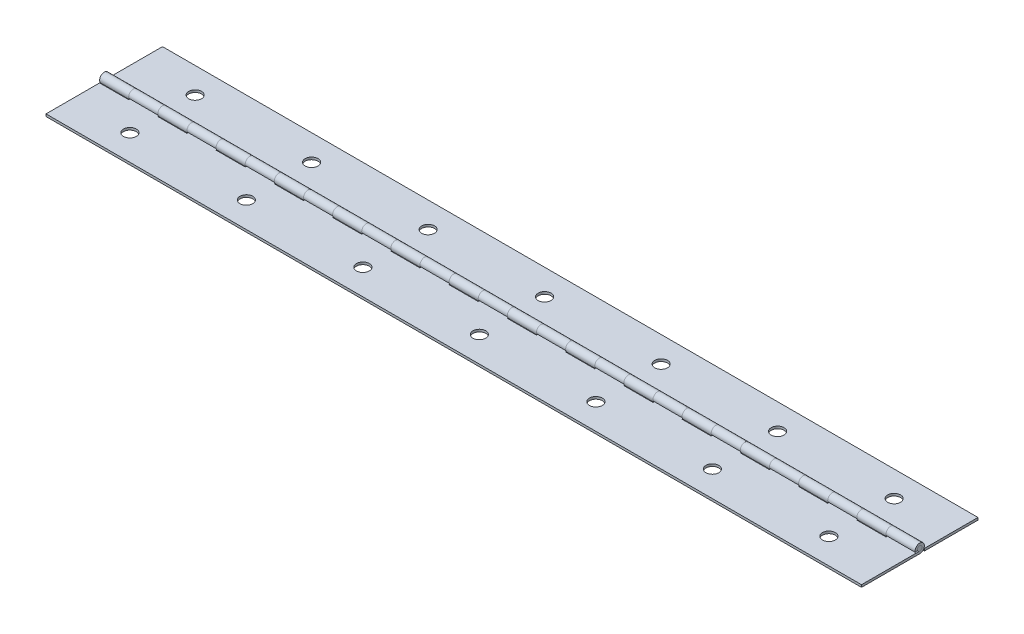
from build123d import *

# Parameters (mm, degrees)
BOSS_EXTRUDE1_DEPTH                  = 1828.8
SKETCH2_W                            = 12.7
SKETCH2_H                            = 4.064
CUT_EXTRUDE1_DEPTH                   = 1829.978920137
LPATTERN1_COUNT                      = 72
LPATTERN1_PITCH                      = 25.4
BOSS_EXTRUDE2_DEPTH                  = 1828.8
SKETCH4_W                            = 12.7
SKETCH4_H                            = 4.064
CUT_EXTRUDE2_DEPTH                   = 1829.978920137
LPATTERN3_COUNT                      = 72
LPATTERN3_PITCH                      = 25.4
SKETCH5_R                            = 1.016
BOSS_EXTRUDE4_DEPTH                  = 1828.8
SKETCH7_W                            = 2.8067
SKETCH7_H                            = 1.016
F_2_0_221_DIAMETER_HOLE1_AT_2_COUNT  = 2
F_2_0_221_DIAMETER_HOLE1_AT_2_PITCH  = 50.8
F_2_0_221_DIAMETER_HOLE1_AT_3_COUNT  = 2
F_2_0_221_DIAMETER_HOLE1_AT_3_PITCH  = 101.6
F_2_0_221_DIAMETER_HOLE1_AT_4_COUNT  = 2
F_2_0_221_DIAMETER_HOLE1_AT_4_PITCH  = 152.4
F_2_0_221_DIAMETER_HOLE1_AT_5_COUNT  = 2
F_2_0_221_DIAMETER_HOLE1_AT_5_PITCH  = 203.2
F_2_0_221_DIAMETER_HOLE1_AT_6_COUNT  = 2
F_2_0_221_DIAMETER_HOLE1_AT_6_PITCH  = 254
F_2_0_221_DIAMETER_HOLE1_AT_7_COUNT  = 2
F_2_0_221_DIAMETER_HOLE1_AT_7_PITCH  = 304.8
F_2_0_221_DIAMETER_HOLE1_AT_8_COUNT  = 2
F_2_0_221_DIAMETER_HOLE1_AT_8_PITCH  = 355.6
F_2_0_221_DIAMETER_HOLE1_AT_9_COUNT  = 2
F_2_0_221_DIAMETER_HOLE1_AT_9_PITCH  = 406.4
F_2_0_221_DIAMETER_HOLE1_AT_10_COUNT = 2
F_2_0_221_DIAMETER_HOLE1_AT_10_PITCH = 457.2
F_2_0_221_DIAMETER_HOLE1_AT_11_COUNT = 2
F_2_0_221_DIAMETER_HOLE1_AT_11_PITCH = 508
F_2_0_221_DIAMETER_HOLE1_AT_12_COUNT = 2
F_2_0_221_DIAMETER_HOLE1_AT_12_PITCH = 558.8
F_2_0_221_DIAMETER_HOLE1_AT_13_COUNT = 2
F_2_0_221_DIAMETER_HOLE1_AT_13_PITCH = 609.6
F_2_0_221_DIAMETER_HOLE1_AT_14_COUNT = 2
F_2_0_221_DIAMETER_HOLE1_AT_14_PITCH = 660.4
F_2_0_221_DIAMETER_HOLE1_AT_15_COUNT = 2
F_2_0_221_DIAMETER_HOLE1_AT_15_PITCH = 711.2
F_2_0_221_DIAMETER_HOLE1_AT_16_COUNT = 2
F_2_0_221_DIAMETER_HOLE1_AT_16_PITCH = 762
F_2_0_221_DIAMETER_HOLE1_AT_17_COUNT = 2
F_2_0_221_DIAMETER_HOLE1_AT_17_PITCH = 812.8
F_2_0_221_DIAMETER_HOLE1_AT_18_COUNT = 2
F_2_0_221_DIAMETER_HOLE1_AT_18_PITCH = 863.6
F_2_0_221_DIAMETER_HOLE1_AT_19_COUNT = 2
F_2_0_221_DIAMETER_HOLE1_AT_19_PITCH = 914.4
F_2_0_221_DIAMETER_HOLE1_AT_20_COUNT = 2
F_2_0_221_DIAMETER_HOLE1_AT_20_PITCH = 965.2
F_2_0_221_DIAMETER_HOLE1_AT_21_COUNT = 2
F_2_0_221_DIAMETER_HOLE1_AT_21_PITCH = 1016
F_2_0_221_DIAMETER_HOLE1_AT_22_COUNT = 2
F_2_0_221_DIAMETER_HOLE1_AT_22_PITCH = 1066.8
F_2_0_221_DIAMETER_HOLE1_AT_23_COUNT = 2
F_2_0_221_DIAMETER_HOLE1_AT_23_PITCH = 1117.6
F_2_0_221_DIAMETER_HOLE1_AT_24_COUNT = 2
F_2_0_221_DIAMETER_HOLE1_AT_24_PITCH = 1168.4
F_2_0_221_DIAMETER_HOLE1_AT_25_COUNT = 2
F_2_0_221_DIAMETER_HOLE1_AT_25_PITCH = 1219.2
F_2_0_221_DIAMETER_HOLE1_AT_26_COUNT = 2
F_2_0_221_DIAMETER_HOLE1_AT_26_PITCH = 1270
F_2_0_221_DIAMETER_HOLE1_AT_27_COUNT = 2
F_2_0_221_DIAMETER_HOLE1_AT_27_PITCH = 1320.8
F_2_0_221_DIAMETER_HOLE1_AT_28_COUNT = 2
F_2_0_221_DIAMETER_HOLE1_AT_28_PITCH = 1371.6
F_2_0_221_DIAMETER_HOLE1_AT_29_COUNT = 2
F_2_0_221_DIAMETER_HOLE1_AT_29_PITCH = 1422.4
F_2_0_221_DIAMETER_HOLE1_AT_30_COUNT = 2
F_2_0_221_DIAMETER_HOLE1_AT_30_PITCH = 1473.2
F_2_0_221_DIAMETER_HOLE1_AT_31_COUNT = 2
F_2_0_221_DIAMETER_HOLE1_AT_31_PITCH = 1524
F_2_0_221_DIAMETER_HOLE1_AT_32_COUNT = 2
F_2_0_221_DIAMETER_HOLE1_AT_32_PITCH = 1574.8
F_2_0_221_DIAMETER_HOLE1_AT_33_COUNT = 2
F_2_0_221_DIAMETER_HOLE1_AT_33_PITCH = 1625.6
F_2_0_221_DIAMETER_HOLE1_AT_34_COUNT = 2
F_2_0_221_DIAMETER_HOLE1_AT_34_PITCH = 1676.4
F_2_0_221_DIAMETER_HOLE1_AT_35_COUNT = 2
F_2_0_221_DIAMETER_HOLE1_AT_35_PITCH = 1727.2
F_2_0_221_DIAMETER_HOLE1_AT_36_COUNT = 2
F_2_0_221_DIAMETER_HOLE1_AT_36_PITCH = 1778
SKETCH9_W                            = 2.8067
SKETCH9_H                            = 1.016
F_2_0_221_DIAMETER_HOLE2_AT_2_COUNT  = 2
F_2_0_221_DIAMETER_HOLE2_AT_2_PITCH  = 50.8
F_2_0_221_DIAMETER_HOLE2_AT_3_COUNT  = 2
F_2_0_221_DIAMETER_HOLE2_AT_3_PITCH  = 101.6
F_2_0_221_DIAMETER_HOLE2_AT_4_COUNT  = 2
F_2_0_221_DIAMETER_HOLE2_AT_4_PITCH  = 152.4
F_2_0_221_DIAMETER_HOLE2_AT_5_COUNT  = 2
F_2_0_221_DIAMETER_HOLE2_AT_5_PITCH  = 203.2
F_2_0_221_DIAMETER_HOLE2_AT_6_COUNT  = 2
F_2_0_221_DIAMETER_HOLE2_AT_6_PITCH  = 254
F_2_0_221_DIAMETER_HOLE2_AT_7_COUNT  = 2
F_2_0_221_DIAMETER_HOLE2_AT_7_PITCH  = 304.8
F_2_0_221_DIAMETER_HOLE2_AT_8_COUNT  = 2
F_2_0_221_DIAMETER_HOLE2_AT_8_PITCH  = 355.6
F_2_0_221_DIAMETER_HOLE2_AT_9_COUNT  = 2
F_2_0_221_DIAMETER_HOLE2_AT_9_PITCH  = 406.4
F_2_0_221_DIAMETER_HOLE2_AT_10_COUNT = 2
F_2_0_221_DIAMETER_HOLE2_AT_10_PITCH = 457.2
F_2_0_221_DIAMETER_HOLE2_AT_11_COUNT = 2
F_2_0_221_DIAMETER_HOLE2_AT_11_PITCH = 508
F_2_0_221_DIAMETER_HOLE2_AT_12_COUNT = 2
F_2_0_221_DIAMETER_HOLE2_AT_12_PITCH = 558.8
F_2_0_221_DIAMETER_HOLE2_AT_13_COUNT = 2
F_2_0_221_DIAMETER_HOLE2_AT_13_PITCH = 609.6
F_2_0_221_DIAMETER_HOLE2_AT_14_COUNT = 2
F_2_0_221_DIAMETER_HOLE2_AT_14_PITCH = 660.4
F_2_0_221_DIAMETER_HOLE2_AT_15_COUNT = 2
F_2_0_221_DIAMETER_HOLE2_AT_15_PITCH = 711.2
F_2_0_221_DIAMETER_HOLE2_AT_16_COUNT = 2
F_2_0_221_DIAMETER_HOLE2_AT_16_PITCH = 762
F_2_0_221_DIAMETER_HOLE2_AT_17_COUNT = 2
F_2_0_221_DIAMETER_HOLE2_AT_17_PITCH = 812.8
F_2_0_221_DIAMETER_HOLE2_AT_18_COUNT = 2
F_2_0_221_DIAMETER_HOLE2_AT_18_PITCH = 863.6
F_2_0_221_DIAMETER_HOLE2_AT_19_COUNT = 2
F_2_0_221_DIAMETER_HOLE2_AT_19_PITCH = 914.4
F_2_0_221_DIAMETER_HOLE2_AT_20_COUNT = 2
F_2_0_221_DIAMETER_HOLE2_AT_20_PITCH = 965.2
F_2_0_221_DIAMETER_HOLE2_AT_21_COUNT = 2
F_2_0_221_DIAMETER_HOLE2_AT_21_PITCH = 1016
F_2_0_221_DIAMETER_HOLE2_AT_22_COUNT = 2
F_2_0_221_DIAMETER_HOLE2_AT_22_PITCH = 1066.8
F_2_0_221_DIAMETER_HOLE2_AT_23_COUNT = 2
F_2_0_221_DIAMETER_HOLE2_AT_23_PITCH = 1117.6
F_2_0_221_DIAMETER_HOLE2_AT_24_COUNT = 2
F_2_0_221_DIAMETER_HOLE2_AT_24_PITCH = 1168.4
F_2_0_221_DIAMETER_HOLE2_AT_25_COUNT = 2
F_2_0_221_DIAMETER_HOLE2_AT_25_PITCH = 1219.2
F_2_0_221_DIAMETER_HOLE2_AT_26_COUNT = 2
F_2_0_221_DIAMETER_HOLE2_AT_26_PITCH = 1270
F_2_0_221_DIAMETER_HOLE2_AT_27_COUNT = 2
F_2_0_221_DIAMETER_HOLE2_AT_27_PITCH = 1320.8
F_2_0_221_DIAMETER_HOLE2_AT_28_COUNT = 2
F_2_0_221_DIAMETER_HOLE2_AT_28_PITCH = 1371.6
F_2_0_221_DIAMETER_HOLE2_AT_29_COUNT = 2
F_2_0_221_DIAMETER_HOLE2_AT_29_PITCH = 1422.4
F_2_0_221_DIAMETER_HOLE2_AT_30_COUNT = 2
F_2_0_221_DIAMETER_HOLE2_AT_30_PITCH = 1473.2
F_2_0_221_DIAMETER_HOLE2_AT_31_COUNT = 2
F_2_0_221_DIAMETER_HOLE2_AT_31_PITCH = 1524
F_2_0_221_DIAMETER_HOLE2_AT_32_COUNT = 2
F_2_0_221_DIAMETER_HOLE2_AT_32_PITCH = 1574.8
F_2_0_221_DIAMETER_HOLE2_AT_33_COUNT = 2
F_2_0_221_DIAMETER_HOLE2_AT_33_PITCH = 1625.6
F_2_0_221_DIAMETER_HOLE2_AT_34_COUNT = 2
F_2_0_221_DIAMETER_HOLE2_AT_34_PITCH = 1676.4
F_2_0_221_DIAMETER_HOLE2_AT_35_COUNT = 2
F_2_0_221_DIAMETER_HOLE2_AT_35_PITCH = 1727.2
F_2_0_221_DIAMETER_HOLE2_AT_36_COUNT = 2
F_2_0_221_DIAMETER_HOLE2_AT_36_PITCH = 1778
CUT_EXTRUDE3_DEPTH                   = 1829.978920137
CUT_EXTRUDE3_DEPTH_BACK              = 1829.978920137
SKETCH10_W                           = 1473.2
SKETCH10_H                           = 50.8


with BuildPart() as part:
    # Sketch1 → Boss-Extrude1 (new body)
    with BuildSketch(Plane(origin=(0, 0, 0), x_dir=(0, 0, -1), z_dir=(1, 0, 0))):
        with BuildLine():
            Line((25.4, 1.016), (0, 1.016))
            ThreePointArc((0, 1.016), (-0.622170395, 2.835218526), (0.98373777, 1.778))
            Line((0.98373777, 1.778), (1.96747554, 1.524))
            ThreePointArc((1.96747554, 1.524), (-1.244340789, 3.638437051), (0, 0))
            Line((0, 0), (25.4, 0))
            Line((25.4, 0), (25.4, 1.016))
        make_face()
    extrude(amount=BOSS_EXTRUDE1_DEPTH)

    # Sketch2 → Cut-Extrude1 (cut, symmetric)
    with BuildSketch(Plane(origin=(0, 1.016, 0), x_dir=(1, 0, 0), z_dir=(0, 1, 0))):
        with Locations((19.05, 0)):
            Rectangle(SKETCH2_W, SKETCH2_H)
    cut_extrude1 = extrude(amount=CUT_EXTRUDE1_DEPTH, both=True, mode=Mode.SUBTRACT)

    # LPattern1: Cut-Extrude1 ×72
    with Locations(*[(i * LPATTERN1_PITCH, 0, 0) for i in range(1, LPATTERN1_COUNT)]):
        add(cut_extrude1, mode=Mode.SUBTRACT)

    # Sketch9 → #2 (0.221) Diameter Hole2 (revolve, cut)
    with BuildSketch(Plane(origin=(25.4, 1.016, -14.224), x_dir=(0, 0, 1), z_dir=(1, 0, 0))):
        with Locations((1.40335, 0.508)):
            Rectangle(SKETCH9_W, SKETCH9_H)
    f_2_0_221_diameter_hole2 = revolve(axis=Axis((25.4, 7.366, -14.224), (0, -1, 0)), mode=Mode.SUBTRACT)

    # #2 (0.221) Diameter Hole2 at 2: #2 (0.221) Diameter Hole2 ×2
    with Locations(*[(i * F_2_0_221_DIAMETER_HOLE2_AT_2_PITCH, 0, 0) for i in range(1, F_2_0_221_DIAMETER_HOLE2_AT_2_COUNT)]):
        add(f_2_0_221_diameter_hole2, mode=Mode.SUBTRACT)

    # #2 (0.221) Diameter Hole2 at 3: #2 (0.221) Diameter Hole2 ×2
    with Locations(*[(i * F_2_0_221_DIAMETER_HOLE2_AT_3_PITCH, 0, 0) for i in range(1, F_2_0_221_DIAMETER_HOLE2_AT_3_COUNT)]):
        add(f_2_0_221_diameter_hole2, mode=Mode.SUBTRACT)

    # #2 (0.221) Diameter Hole2 at 4: #2 (0.221) Diameter Hole2 ×2
    with Locations(*[(i * F_2_0_221_DIAMETER_HOLE2_AT_4_PITCH, 0, 0) for i in range(1, F_2_0_221_DIAMETER_HOLE2_AT_4_COUNT)]):
        add(f_2_0_221_diameter_hole2, mode=Mode.SUBTRACT)

    # #2 (0.221) Diameter Hole2 at 5: #2 (0.221) Diameter Hole2 ×2
    with Locations(*[(i * F_2_0_221_DIAMETER_HOLE2_AT_5_PITCH, 0, 0) for i in range(1, F_2_0_221_DIAMETER_HOLE2_AT_5_COUNT)]):
        add(f_2_0_221_diameter_hole2, mode=Mode.SUBTRACT)

    # #2 (0.221) Diameter Hole2 at 6: #2 (0.221) Diameter Hole2 ×2
    with Locations(*[(i * F_2_0_221_DIAMETER_HOLE2_AT_6_PITCH, 0, 0) for i in range(1, F_2_0_221_DIAMETER_HOLE2_AT_6_COUNT)]):
        add(f_2_0_221_diameter_hole2, mode=Mode.SUBTRACT)

    # #2 (0.221) Diameter Hole2 at 7: #2 (0.221) Diameter Hole2 ×2
    with Locations(*[(i * F_2_0_221_DIAMETER_HOLE2_AT_7_PITCH, 0, 0) for i in range(1, F_2_0_221_DIAMETER_HOLE2_AT_7_COUNT)]):
        add(f_2_0_221_diameter_hole2, mode=Mode.SUBTRACT)

    # #2 (0.221) Diameter Hole2 at 8: #2 (0.221) Diameter Hole2 ×2
    with Locations(*[(i * F_2_0_221_DIAMETER_HOLE2_AT_8_PITCH, 0, 0) for i in range(1, F_2_0_221_DIAMETER_HOLE2_AT_8_COUNT)]):
        add(f_2_0_221_diameter_hole2, mode=Mode.SUBTRACT)

    # #2 (0.221) Diameter Hole2 at 9: #2 (0.221) Diameter Hole2 ×2
    with Locations(*[(i * F_2_0_221_DIAMETER_HOLE2_AT_9_PITCH, 0, 0) for i in range(1, F_2_0_221_DIAMETER_HOLE2_AT_9_COUNT)]):
        add(f_2_0_221_diameter_hole2, mode=Mode.SUBTRACT)

    # #2 (0.221) Diameter Hole2 at 10: #2 (0.221) Diameter Hole2 ×2
    with Locations(*[(i * F_2_0_221_DIAMETER_HOLE2_AT_10_PITCH, 0, 0) for i in range(1, F_2_0_221_DIAMETER_HOLE2_AT_10_COUNT)]):
        add(f_2_0_221_diameter_hole2, mode=Mode.SUBTRACT)

    # #2 (0.221) Diameter Hole2 at 11: #2 (0.221) Diameter Hole2 ×2
    with Locations(*[(i * F_2_0_221_DIAMETER_HOLE2_AT_11_PITCH, 0, 0) for i in range(1, F_2_0_221_DIAMETER_HOLE2_AT_11_COUNT)]):
        add(f_2_0_221_diameter_hole2, mode=Mode.SUBTRACT)

    # #2 (0.221) Diameter Hole2 at 12: #2 (0.221) Diameter Hole2 ×2
    with Locations(*[(i * F_2_0_221_DIAMETER_HOLE2_AT_12_PITCH, 0, 0) for i in range(1, F_2_0_221_DIAMETER_HOLE2_AT_12_COUNT)]):
        add(f_2_0_221_diameter_hole2, mode=Mode.SUBTRACT)

    # #2 (0.221) Diameter Hole2 at 13: #2 (0.221) Diameter Hole2 ×2
    with Locations(*[(i * F_2_0_221_DIAMETER_HOLE2_AT_13_PITCH, 0, 0) for i in range(1, F_2_0_221_DIAMETER_HOLE2_AT_13_COUNT)]):
        add(f_2_0_221_diameter_hole2, mode=Mode.SUBTRACT)

    # #2 (0.221) Diameter Hole2 at 14: #2 (0.221) Diameter Hole2 ×2
    with Locations(*[(i * F_2_0_221_DIAMETER_HOLE2_AT_14_PITCH, 0, 0) for i in range(1, F_2_0_221_DIAMETER_HOLE2_AT_14_COUNT)]):
        add(f_2_0_221_diameter_hole2, mode=Mode.SUBTRACT)

    # #2 (0.221) Diameter Hole2 at 15: #2 (0.221) Diameter Hole2 ×2
    with Locations(*[(i * F_2_0_221_DIAMETER_HOLE2_AT_15_PITCH, 0, 0) for i in range(1, F_2_0_221_DIAMETER_HOLE2_AT_15_COUNT)]):
        add(f_2_0_221_diameter_hole2, mode=Mode.SUBTRACT)

    # #2 (0.221) Diameter Hole2 at 16: #2 (0.221) Diameter Hole2 ×2
    with Locations(*[(i * F_2_0_221_DIAMETER_HOLE2_AT_16_PITCH, 0, 0) for i in range(1, F_2_0_221_DIAMETER_HOLE2_AT_16_COUNT)]):
        add(f_2_0_221_diameter_hole2, mode=Mode.SUBTRACT)

    # #2 (0.221) Diameter Hole2 at 17: #2 (0.221) Diameter Hole2 ×2
    with Locations(*[(i * F_2_0_221_DIAMETER_HOLE2_AT_17_PITCH, 0, 0) for i in range(1, F_2_0_221_DIAMETER_HOLE2_AT_17_COUNT)]):
        add(f_2_0_221_diameter_hole2, mode=Mode.SUBTRACT)

    # #2 (0.221) Diameter Hole2 at 18: #2 (0.221) Diameter Hole2 ×2
    with Locations(*[(i * F_2_0_221_DIAMETER_HOLE2_AT_18_PITCH, 0, 0) for i in range(1, F_2_0_221_DIAMETER_HOLE2_AT_18_COUNT)]):
        add(f_2_0_221_diameter_hole2, mode=Mode.SUBTRACT)

    # #2 (0.221) Diameter Hole2 at 19: #2 (0.221) Diameter Hole2 ×2
    with Locations(*[(i * F_2_0_221_DIAMETER_HOLE2_AT_19_PITCH, 0, 0) for i in range(1, F_2_0_221_DIAMETER_HOLE2_AT_19_COUNT)]):
        add(f_2_0_221_diameter_hole2, mode=Mode.SUBTRACT)

    # #2 (0.221) Diameter Hole2 at 20: #2 (0.221) Diameter Hole2 ×2
    with Locations(*[(i * F_2_0_221_DIAMETER_HOLE2_AT_20_PITCH, 0, 0) for i in range(1, F_2_0_221_DIAMETER_HOLE2_AT_20_COUNT)]):
        add(f_2_0_221_diameter_hole2, mode=Mode.SUBTRACT)

    # #2 (0.221) Diameter Hole2 at 21: #2 (0.221) Diameter Hole2 ×2
    with Locations(*[(i * F_2_0_221_DIAMETER_HOLE2_AT_21_PITCH, 0, 0) for i in range(1, F_2_0_221_DIAMETER_HOLE2_AT_21_COUNT)]):
        add(f_2_0_221_diameter_hole2, mode=Mode.SUBTRACT)

    # #2 (0.221) Diameter Hole2 at 22: #2 (0.221) Diameter Hole2 ×2
    with Locations(*[(i * F_2_0_221_DIAMETER_HOLE2_AT_22_PITCH, 0, 0) for i in range(1, F_2_0_221_DIAMETER_HOLE2_AT_22_COUNT)]):
        add(f_2_0_221_diameter_hole2, mode=Mode.SUBTRACT)

    # #2 (0.221) Diameter Hole2 at 23: #2 (0.221) Diameter Hole2 ×2
    with Locations(*[(i * F_2_0_221_DIAMETER_HOLE2_AT_23_PITCH, 0, 0) for i in range(1, F_2_0_221_DIAMETER_HOLE2_AT_23_COUNT)]):
        add(f_2_0_221_diameter_hole2, mode=Mode.SUBTRACT)

    # #2 (0.221) Diameter Hole2 at 24: #2 (0.221) Diameter Hole2 ×2
    with Locations(*[(i * F_2_0_221_DIAMETER_HOLE2_AT_24_PITCH, 0, 0) for i in range(1, F_2_0_221_DIAMETER_HOLE2_AT_24_COUNT)]):
        add(f_2_0_221_diameter_hole2, mode=Mode.SUBTRACT)

    # #2 (0.221) Diameter Hole2 at 25: #2 (0.221) Diameter Hole2 ×2
    with Locations(*[(i * F_2_0_221_DIAMETER_HOLE2_AT_25_PITCH, 0, 0) for i in range(1, F_2_0_221_DIAMETER_HOLE2_AT_25_COUNT)]):
        add(f_2_0_221_diameter_hole2, mode=Mode.SUBTRACT)

    # #2 (0.221) Diameter Hole2 at 26: #2 (0.221) Diameter Hole2 ×2
    with Locations(*[(i * F_2_0_221_DIAMETER_HOLE2_AT_26_PITCH, 0, 0) for i in range(1, F_2_0_221_DIAMETER_HOLE2_AT_26_COUNT)]):
        add(f_2_0_221_diameter_hole2, mode=Mode.SUBTRACT)

    # #2 (0.221) Diameter Hole2 at 27: #2 (0.221) Diameter Hole2 ×2
    with Locations(*[(i * F_2_0_221_DIAMETER_HOLE2_AT_27_PITCH, 0, 0) for i in range(1, F_2_0_221_DIAMETER_HOLE2_AT_27_COUNT)]):
        add(f_2_0_221_diameter_hole2, mode=Mode.SUBTRACT)

    # #2 (0.221) Diameter Hole2 at 28: #2 (0.221) Diameter Hole2 ×2
    with Locations(*[(i * F_2_0_221_DIAMETER_HOLE2_AT_28_PITCH, 0, 0) for i in range(1, F_2_0_221_DIAMETER_HOLE2_AT_28_COUNT)]):
        add(f_2_0_221_diameter_hole2, mode=Mode.SUBTRACT)

    # #2 (0.221) Diameter Hole2 at 29: #2 (0.221) Diameter Hole2 ×2
    with Locations(*[(i * F_2_0_221_DIAMETER_HOLE2_AT_29_PITCH, 0, 0) for i in range(1, F_2_0_221_DIAMETER_HOLE2_AT_29_COUNT)]):
        add(f_2_0_221_diameter_hole2, mode=Mode.SUBTRACT)

    # #2 (0.221) Diameter Hole2 at 30: #2 (0.221) Diameter Hole2 ×2
    with Locations(*[(i * F_2_0_221_DIAMETER_HOLE2_AT_30_PITCH, 0, 0) for i in range(1, F_2_0_221_DIAMETER_HOLE2_AT_30_COUNT)]):
        add(f_2_0_221_diameter_hole2, mode=Mode.SUBTRACT)

    # #2 (0.221) Diameter Hole2 at 31: #2 (0.221) Diameter Hole2 ×2
    with Locations(*[(i * F_2_0_221_DIAMETER_HOLE2_AT_31_PITCH, 0, 0) for i in range(1, F_2_0_221_DIAMETER_HOLE2_AT_31_COUNT)]):
        add(f_2_0_221_diameter_hole2, mode=Mode.SUBTRACT)

    # #2 (0.221) Diameter Hole2 at 32: #2 (0.221) Diameter Hole2 ×2
    with Locations(*[(i * F_2_0_221_DIAMETER_HOLE2_AT_32_PITCH, 0, 0) for i in range(1, F_2_0_221_DIAMETER_HOLE2_AT_32_COUNT)]):
        add(f_2_0_221_diameter_hole2, mode=Mode.SUBTRACT)

    # #2 (0.221) Diameter Hole2 at 33: #2 (0.221) Diameter Hole2 ×2
    with Locations(*[(i * F_2_0_221_DIAMETER_HOLE2_AT_33_PITCH, 0, 0) for i in range(1, F_2_0_221_DIAMETER_HOLE2_AT_33_COUNT)]):
        add(f_2_0_221_diameter_hole2, mode=Mode.SUBTRACT)

    # #2 (0.221) Diameter Hole2 at 34: #2 (0.221) Diameter Hole2 ×2
    with Locations(*[(i * F_2_0_221_DIAMETER_HOLE2_AT_34_PITCH, 0, 0) for i in range(1, F_2_0_221_DIAMETER_HOLE2_AT_34_COUNT)]):
        add(f_2_0_221_diameter_hole2, mode=Mode.SUBTRACT)

    # #2 (0.221) Diameter Hole2 at 35: #2 (0.221) Diameter Hole2 ×2
    with Locations(*[(i * F_2_0_221_DIAMETER_HOLE2_AT_35_PITCH, 0, 0) for i in range(1, F_2_0_221_DIAMETER_HOLE2_AT_35_COUNT)]):
        add(f_2_0_221_diameter_hole2, mode=Mode.SUBTRACT)

    # #2 (0.221) Diameter Hole2 at 36: #2 (0.221) Diameter Hole2 ×2
    with Locations(*[(i * F_2_0_221_DIAMETER_HOLE2_AT_36_PITCH, 0, 0) for i in range(1, F_2_0_221_DIAMETER_HOLE2_AT_36_COUNT)]):
        add(f_2_0_221_diameter_hole2, mode=Mode.SUBTRACT)


with BuildPart() as body_2:
    # Sketch3 → Boss-Extrude2 (new body)
    with BuildSketch(Plane.ZY):
        with BuildLine():
            Line((25.4, 0), (0, 0))
            ThreePointArc((0, 0), (-1.244340789, 3.638437051), (1.96747554, 1.524))
            Line((1.96747554, 1.524), (0.98373777, 1.778))
            ThreePointArc((0.98373777, 1.778), (-0.622170395, 2.835218526), (0, 1.016))
            Line((0, 1.016), (25.4, 1.016))
            Line((25.4, 1.016), (25.4, 0))
        make_face()
    extrude(amount=-BOSS_EXTRUDE2_DEPTH)

    # Sketch4 → Cut-Extrude2 (cut, symmetric)
    with BuildSketch(Plane(origin=(0, 1.016, 0), x_dir=(1, 0, 0), z_dir=(0, 1, 0))):
        with Locations((6.35, 0)):
            Rectangle(SKETCH4_W, SKETCH4_H)
    cut_extrude2 = extrude(amount=CUT_EXTRUDE2_DEPTH, both=True, mode=Mode.SUBTRACT)

    # LPattern3: Cut-Extrude2 ×72
    with Locations(*[(i * LPATTERN3_PITCH, 0, 0) for i in range(1, LPATTERN3_COUNT)]):
        add(cut_extrude2, mode=Mode.SUBTRACT)

    # Sketch7 → #2 (0.221) Diameter Hole1 (revolve, cut)
    with BuildSketch(Plane(origin=(25.4, 1.016, 14.224), x_dir=(0, 0, 1), z_dir=(1, 0, 0))):
        with Locations((1.40335, 0.508)):
            Rectangle(SKETCH7_W, SKETCH7_H)
    f_2_0_221_diameter_hole1 = revolve(axis=Axis((25.4, 7.366, 14.224), (0, -1, 0)), mode=Mode.SUBTRACT)

    # #2 (0.221) Diameter Hole1 at 2: #2 (0.221) Diameter Hole1 ×2
    with Locations(*[(i * F_2_0_221_DIAMETER_HOLE1_AT_2_PITCH, 0, 0) for i in range(1, F_2_0_221_DIAMETER_HOLE1_AT_2_COUNT)]):
        add(f_2_0_221_diameter_hole1, mode=Mode.SUBTRACT)

    # #2 (0.221) Diameter Hole1 at 3: #2 (0.221) Diameter Hole1 ×2
    with Locations(*[(i * F_2_0_221_DIAMETER_HOLE1_AT_3_PITCH, 0, 0) for i in range(1, F_2_0_221_DIAMETER_HOLE1_AT_3_COUNT)]):
        add(f_2_0_221_diameter_hole1, mode=Mode.SUBTRACT)

    # #2 (0.221) Diameter Hole1 at 4: #2 (0.221) Diameter Hole1 ×2
    with Locations(*[(i * F_2_0_221_DIAMETER_HOLE1_AT_4_PITCH, 0, 0) for i in range(1, F_2_0_221_DIAMETER_HOLE1_AT_4_COUNT)]):
        add(f_2_0_221_diameter_hole1, mode=Mode.SUBTRACT)

    # #2 (0.221) Diameter Hole1 at 5: #2 (0.221) Diameter Hole1 ×2
    with Locations(*[(i * F_2_0_221_DIAMETER_HOLE1_AT_5_PITCH, 0, 0) for i in range(1, F_2_0_221_DIAMETER_HOLE1_AT_5_COUNT)]):
        add(f_2_0_221_diameter_hole1, mode=Mode.SUBTRACT)

    # #2 (0.221) Diameter Hole1 at 6: #2 (0.221) Diameter Hole1 ×2
    with Locations(*[(i * F_2_0_221_DIAMETER_HOLE1_AT_6_PITCH, 0, 0) for i in range(1, F_2_0_221_DIAMETER_HOLE1_AT_6_COUNT)]):
        add(f_2_0_221_diameter_hole1, mode=Mode.SUBTRACT)

    # #2 (0.221) Diameter Hole1 at 7: #2 (0.221) Diameter Hole1 ×2
    with Locations(*[(i * F_2_0_221_DIAMETER_HOLE1_AT_7_PITCH, 0, 0) for i in range(1, F_2_0_221_DIAMETER_HOLE1_AT_7_COUNT)]):
        add(f_2_0_221_diameter_hole1, mode=Mode.SUBTRACT)

    # #2 (0.221) Diameter Hole1 at 8: #2 (0.221) Diameter Hole1 ×2
    with Locations(*[(i * F_2_0_221_DIAMETER_HOLE1_AT_8_PITCH, 0, 0) for i in range(1, F_2_0_221_DIAMETER_HOLE1_AT_8_COUNT)]):
        add(f_2_0_221_diameter_hole1, mode=Mode.SUBTRACT)

    # #2 (0.221) Diameter Hole1 at 9: #2 (0.221) Diameter Hole1 ×2
    with Locations(*[(i * F_2_0_221_DIAMETER_HOLE1_AT_9_PITCH, 0, 0) for i in range(1, F_2_0_221_DIAMETER_HOLE1_AT_9_COUNT)]):
        add(f_2_0_221_diameter_hole1, mode=Mode.SUBTRACT)

    # #2 (0.221) Diameter Hole1 at 10: #2 (0.221) Diameter Hole1 ×2
    with Locations(*[(i * F_2_0_221_DIAMETER_HOLE1_AT_10_PITCH, 0, 0) for i in range(1, F_2_0_221_DIAMETER_HOLE1_AT_10_COUNT)]):
        add(f_2_0_221_diameter_hole1, mode=Mode.SUBTRACT)

    # #2 (0.221) Diameter Hole1 at 11: #2 (0.221) Diameter Hole1 ×2
    with Locations(*[(i * F_2_0_221_DIAMETER_HOLE1_AT_11_PITCH, 0, 0) for i in range(1, F_2_0_221_DIAMETER_HOLE1_AT_11_COUNT)]):
        add(f_2_0_221_diameter_hole1, mode=Mode.SUBTRACT)

    # #2 (0.221) Diameter Hole1 at 12: #2 (0.221) Diameter Hole1 ×2
    with Locations(*[(i * F_2_0_221_DIAMETER_HOLE1_AT_12_PITCH, 0, 0) for i in range(1, F_2_0_221_DIAMETER_HOLE1_AT_12_COUNT)]):
        add(f_2_0_221_diameter_hole1, mode=Mode.SUBTRACT)

    # #2 (0.221) Diameter Hole1 at 13: #2 (0.221) Diameter Hole1 ×2
    with Locations(*[(i * F_2_0_221_DIAMETER_HOLE1_AT_13_PITCH, 0, 0) for i in range(1, F_2_0_221_DIAMETER_HOLE1_AT_13_COUNT)]):
        add(f_2_0_221_diameter_hole1, mode=Mode.SUBTRACT)

    # #2 (0.221) Diameter Hole1 at 14: #2 (0.221) Diameter Hole1 ×2
    with Locations(*[(i * F_2_0_221_DIAMETER_HOLE1_AT_14_PITCH, 0, 0) for i in range(1, F_2_0_221_DIAMETER_HOLE1_AT_14_COUNT)]):
        add(f_2_0_221_diameter_hole1, mode=Mode.SUBTRACT)

    # #2 (0.221) Diameter Hole1 at 15: #2 (0.221) Diameter Hole1 ×2
    with Locations(*[(i * F_2_0_221_DIAMETER_HOLE1_AT_15_PITCH, 0, 0) for i in range(1, F_2_0_221_DIAMETER_HOLE1_AT_15_COUNT)]):
        add(f_2_0_221_diameter_hole1, mode=Mode.SUBTRACT)

    # #2 (0.221) Diameter Hole1 at 16: #2 (0.221) Diameter Hole1 ×2
    with Locations(*[(i * F_2_0_221_DIAMETER_HOLE1_AT_16_PITCH, 0, 0) for i in range(1, F_2_0_221_DIAMETER_HOLE1_AT_16_COUNT)]):
        add(f_2_0_221_diameter_hole1, mode=Mode.SUBTRACT)

    # #2 (0.221) Diameter Hole1 at 17: #2 (0.221) Diameter Hole1 ×2
    with Locations(*[(i * F_2_0_221_DIAMETER_HOLE1_AT_17_PITCH, 0, 0) for i in range(1, F_2_0_221_DIAMETER_HOLE1_AT_17_COUNT)]):
        add(f_2_0_221_diameter_hole1, mode=Mode.SUBTRACT)

    # #2 (0.221) Diameter Hole1 at 18: #2 (0.221) Diameter Hole1 ×2
    with Locations(*[(i * F_2_0_221_DIAMETER_HOLE1_AT_18_PITCH, 0, 0) for i in range(1, F_2_0_221_DIAMETER_HOLE1_AT_18_COUNT)]):
        add(f_2_0_221_diameter_hole1, mode=Mode.SUBTRACT)

    # #2 (0.221) Diameter Hole1 at 19: #2 (0.221) Diameter Hole1 ×2
    with Locations(*[(i * F_2_0_221_DIAMETER_HOLE1_AT_19_PITCH, 0, 0) for i in range(1, F_2_0_221_DIAMETER_HOLE1_AT_19_COUNT)]):
        add(f_2_0_221_diameter_hole1, mode=Mode.SUBTRACT)

    # #2 (0.221) Diameter Hole1 at 20: #2 (0.221) Diameter Hole1 ×2
    with Locations(*[(i * F_2_0_221_DIAMETER_HOLE1_AT_20_PITCH, 0, 0) for i in range(1, F_2_0_221_DIAMETER_HOLE1_AT_20_COUNT)]):
        add(f_2_0_221_diameter_hole1, mode=Mode.SUBTRACT)

    # #2 (0.221) Diameter Hole1 at 21: #2 (0.221) Diameter Hole1 ×2
    with Locations(*[(i * F_2_0_221_DIAMETER_HOLE1_AT_21_PITCH, 0, 0) for i in range(1, F_2_0_221_DIAMETER_HOLE1_AT_21_COUNT)]):
        add(f_2_0_221_diameter_hole1, mode=Mode.SUBTRACT)

    # #2 (0.221) Diameter Hole1 at 22: #2 (0.221) Diameter Hole1 ×2
    with Locations(*[(i * F_2_0_221_DIAMETER_HOLE1_AT_22_PITCH, 0, 0) for i in range(1, F_2_0_221_DIAMETER_HOLE1_AT_22_COUNT)]):
        add(f_2_0_221_diameter_hole1, mode=Mode.SUBTRACT)

    # #2 (0.221) Diameter Hole1 at 23: #2 (0.221) Diameter Hole1 ×2
    with Locations(*[(i * F_2_0_221_DIAMETER_HOLE1_AT_23_PITCH, 0, 0) for i in range(1, F_2_0_221_DIAMETER_HOLE1_AT_23_COUNT)]):
        add(f_2_0_221_diameter_hole1, mode=Mode.SUBTRACT)

    # #2 (0.221) Diameter Hole1 at 24: #2 (0.221) Diameter Hole1 ×2
    with Locations(*[(i * F_2_0_221_DIAMETER_HOLE1_AT_24_PITCH, 0, 0) for i in range(1, F_2_0_221_DIAMETER_HOLE1_AT_24_COUNT)]):
        add(f_2_0_221_diameter_hole1, mode=Mode.SUBTRACT)

    # #2 (0.221) Diameter Hole1 at 25: #2 (0.221) Diameter Hole1 ×2
    with Locations(*[(i * F_2_0_221_DIAMETER_HOLE1_AT_25_PITCH, 0, 0) for i in range(1, F_2_0_221_DIAMETER_HOLE1_AT_25_COUNT)]):
        add(f_2_0_221_diameter_hole1, mode=Mode.SUBTRACT)

    # #2 (0.221) Diameter Hole1 at 26: #2 (0.221) Diameter Hole1 ×2
    with Locations(*[(i * F_2_0_221_DIAMETER_HOLE1_AT_26_PITCH, 0, 0) for i in range(1, F_2_0_221_DIAMETER_HOLE1_AT_26_COUNT)]):
        add(f_2_0_221_diameter_hole1, mode=Mode.SUBTRACT)

    # #2 (0.221) Diameter Hole1 at 27: #2 (0.221) Diameter Hole1 ×2
    with Locations(*[(i * F_2_0_221_DIAMETER_HOLE1_AT_27_PITCH, 0, 0) for i in range(1, F_2_0_221_DIAMETER_HOLE1_AT_27_COUNT)]):
        add(f_2_0_221_diameter_hole1, mode=Mode.SUBTRACT)

    # #2 (0.221) Diameter Hole1 at 28: #2 (0.221) Diameter Hole1 ×2
    with Locations(*[(i * F_2_0_221_DIAMETER_HOLE1_AT_28_PITCH, 0, 0) for i in range(1, F_2_0_221_DIAMETER_HOLE1_AT_28_COUNT)]):
        add(f_2_0_221_diameter_hole1, mode=Mode.SUBTRACT)

    # #2 (0.221) Diameter Hole1 at 29: #2 (0.221) Diameter Hole1 ×2
    with Locations(*[(i * F_2_0_221_DIAMETER_HOLE1_AT_29_PITCH, 0, 0) for i in range(1, F_2_0_221_DIAMETER_HOLE1_AT_29_COUNT)]):
        add(f_2_0_221_diameter_hole1, mode=Mode.SUBTRACT)

    # #2 (0.221) Diameter Hole1 at 30: #2 (0.221) Diameter Hole1 ×2
    with Locations(*[(i * F_2_0_221_DIAMETER_HOLE1_AT_30_PITCH, 0, 0) for i in range(1, F_2_0_221_DIAMETER_HOLE1_AT_30_COUNT)]):
        add(f_2_0_221_diameter_hole1, mode=Mode.SUBTRACT)

    # #2 (0.221) Diameter Hole1 at 31: #2 (0.221) Diameter Hole1 ×2
    with Locations(*[(i * F_2_0_221_DIAMETER_HOLE1_AT_31_PITCH, 0, 0) for i in range(1, F_2_0_221_DIAMETER_HOLE1_AT_31_COUNT)]):
        add(f_2_0_221_diameter_hole1, mode=Mode.SUBTRACT)

    # #2 (0.221) Diameter Hole1 at 32: #2 (0.221) Diameter Hole1 ×2
    with Locations(*[(i * F_2_0_221_DIAMETER_HOLE1_AT_32_PITCH, 0, 0) for i in range(1, F_2_0_221_DIAMETER_HOLE1_AT_32_COUNT)]):
        add(f_2_0_221_diameter_hole1, mode=Mode.SUBTRACT)

    # #2 (0.221) Diameter Hole1 at 33: #2 (0.221) Diameter Hole1 ×2
    with Locations(*[(i * F_2_0_221_DIAMETER_HOLE1_AT_33_PITCH, 0, 0) for i in range(1, F_2_0_221_DIAMETER_HOLE1_AT_33_COUNT)]):
        add(f_2_0_221_diameter_hole1, mode=Mode.SUBTRACT)

    # #2 (0.221) Diameter Hole1 at 34: #2 (0.221) Diameter Hole1 ×2
    with Locations(*[(i * F_2_0_221_DIAMETER_HOLE1_AT_34_PITCH, 0, 0) for i in range(1, F_2_0_221_DIAMETER_HOLE1_AT_34_COUNT)]):
        add(f_2_0_221_diameter_hole1, mode=Mode.SUBTRACT)

    # #2 (0.221) Diameter Hole1 at 35: #2 (0.221) Diameter Hole1 ×2
    with Locations(*[(i * F_2_0_221_DIAMETER_HOLE1_AT_35_PITCH, 0, 0) for i in range(1, F_2_0_221_DIAMETER_HOLE1_AT_35_COUNT)]):
        add(f_2_0_221_diameter_hole1, mode=Mode.SUBTRACT)

    # #2 (0.221) Diameter Hole1 at 36: #2 (0.221) Diameter Hole1 ×2
    with Locations(*[(i * F_2_0_221_DIAMETER_HOLE1_AT_36_PITCH, 0, 0) for i in range(1, F_2_0_221_DIAMETER_HOLE1_AT_36_COUNT)]):
        add(f_2_0_221_diameter_hole1, mode=Mode.SUBTRACT)


with BuildPart() as body_3:
    # Sketch5 → Boss-Extrude4 (new body)
    with BuildSketch(Plane.ZY):
        with Locations((0, 2.032)):
            Circle(SKETCH5_R)
    extrude(amount=-BOSS_EXTRUDE4_DEPTH)


with BuildPart() as cut_extrude3_tool:
    # Sketch10 → Cut-Extrude3 (new, two sides: drawn at the far end of the back side and taken through both)
    with BuildSketch(Plane(origin=(0, 1.016, 0), x_dir=(1, 0, 0), z_dir=(0, 1, 0)).offset(-CUT_EXTRUDE3_DEPTH_BACK)):
        with Locations((1092.2, 0)):
            Rectangle(SKETCH10_W, SKETCH10_H)
    extrude(amount=CUT_EXTRUDE3_DEPTH + CUT_EXTRUDE3_DEPTH_BACK)


with BuildPart() as part_1:
    add(part.part)

    # Cut-Extrude3: cut by cut_extrude3_tool
    add(cut_extrude3_tool.part, mode=Mode.SUBTRACT)


with BuildPart() as body_2_1:
    add(body_2.part)

    # Cut-Extrude3: cut by cut_extrude3_tool
    add(cut_extrude3_tool.part, mode=Mode.SUBTRACT)


with BuildPart() as body_3_1:
    add(body_3.part)

    # Cut-Extrude3: cut by cut_extrude3_tool
    add(cut_extrude3_tool.part, mode=Mode.SUBTRACT)


solid = Compound([part_1.part, body_2_1.part, body_3_1.part])
